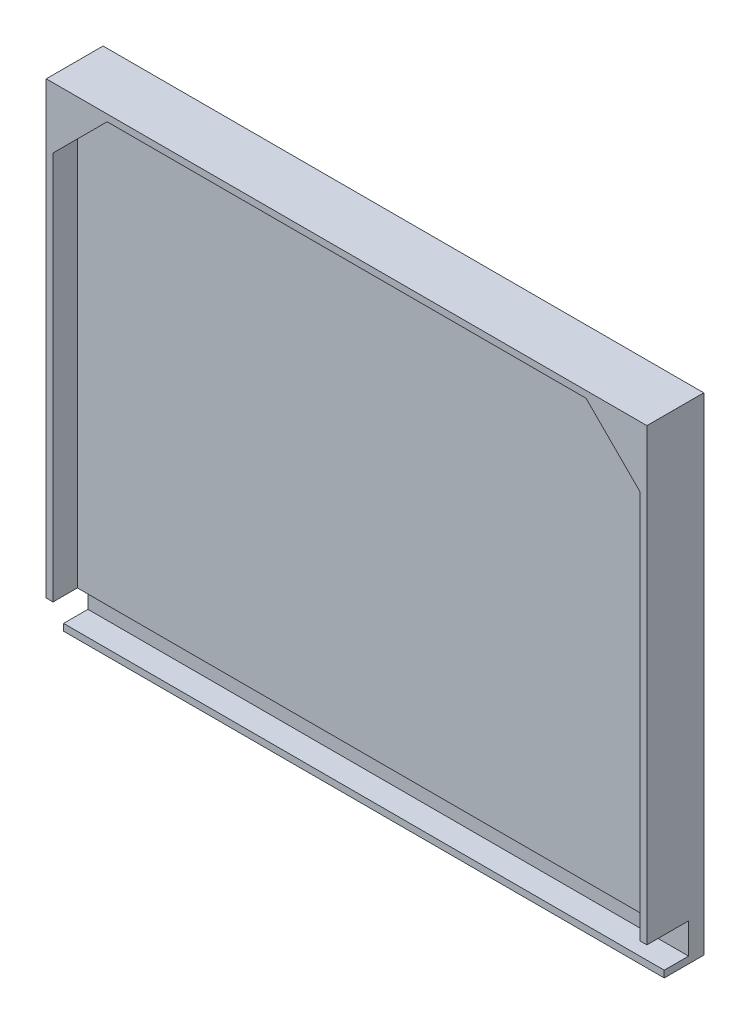
from build123d import *

# Parameters (mm, degrees)
SKETCH1_W            = 281.94
SKETCH1_H            = 228.6
BOSS_EXTRUDE2_DEPTH  = 25.4
SKETCH3_W            = 281.94
SKETCH3_H            = 17.526
CUT_EXTRUDE1_DEPTH   = 8.128
SKETCH4_W            = 11.43
SKETCH4_H            = 211.074
BOSS_EXTRUDE4_DEPTH  = 3.175
SKETCH5_W            = 278.765
SKETCH5_H            = 11.43
BOSS_EXTRUDE9_DEPTH  = 3.175
SKETCH9_W            = 11.43
SKETCH9_H            = 207.899
BOSS_EXTRUDE10_DEPTH = 3.175
SKETCH8_W            = 281.94
SKETCH8_H            = 11.43
BOSS_EXTRUDE11_DEPTH = 3.175
SKETCH10_W           = 281.94
SKETCH10_H           = 14.351
CUT_EXTRUDE2_DEPTH   = 10.16
SKETCH11_W           = 275.59
SKETCH11_H           = 207.899
CUT_EXTRUDE3_DEPTH   = 10.16
CUT_EXTRUDE4_DEPTH   = 10.16
SKETCH13_W           = 281.94
SKETCH13_H           = 3.175
CUT_EXTRUDE5_DEPTH   = 10.16
SHELL4_START         = -65.823170732
SHELL4_DEPTH         = 276.86
BOSS_EXTRUDE12_DEPTH = 3.175


# Read off the part's stored shape, not the designer's step: Shell4
with BuildPart() as part:
    # Sketch1 → Boss-Extrude2 (new body)
    with BuildSketch(Plane.XY):
        with Locations((72.606829268, 16.339634146)):
            Rectangle(SKETCH1_W, SKETCH1_H)
    extrude(amount=BOSS_EXTRUDE2_DEPTH)

    # Sketch3 → Cut-Extrude1 (cut)
    with BuildSketch(Plane.XY.offset(25.4)):
        with Locations((72.606829268, -89.197365854)):
            Rectangle(SKETCH3_W, SKETCH3_H)
    extrude(amount=-CUT_EXTRUDE1_DEPTH, mode=Mode.SUBTRACT)



with BuildPart() as body_2:
    # Sketch4 → Boss-Extrude4 (new body)
    with BuildSketch(Plane.ZY.offset(68.363170732)):
        with Locations((31.115, 25.102634146)):
            Rectangle(SKETCH4_W, SKETCH4_H)
    extrude(amount=-BOSS_EXTRUDE4_DEPTH)


with BuildPart() as part_1:
    add(part.part)

    add(body_2.part)  # Boss-Extrude9 merges body 2
    # Sketch5 → Boss-Extrude9 (add)
    with BuildSketch(Plane(origin=(0, 130.639634146, 0), x_dir=(1, 0, 0), z_dir=(0, 1, 0))):
        with Locations((74.194329268, -31.115)):
            Rectangle(SKETCH5_W, SKETCH5_H)
    extrude(amount=-BOSS_EXTRUDE9_DEPTH)

    # Sketch9 → Boss-Extrude10 (add)
    with BuildSketch(Plane(origin=(213.576829268, 0, 0), x_dir=(0, 0, -1), z_dir=(1, 0, 0))):
        with Locations((-31.115, 23.515134146)):
            Rectangle(SKETCH9_W, SKETCH9_H)
    extrude(amount=-BOSS_EXTRUDE10_DEPTH)


with BuildPart() as body_2_2:
    # Sketch8 → Boss-Extrude11 (new body)
    with BuildSketch(Plane.XZ.offset(97.960365854)):
        with Locations((72.606829268, 22.987)):
            Rectangle(SKETCH8_W, SKETCH8_H)
    extrude(amount=-BOSS_EXTRUDE11_DEPTH)

    # Combine1: union part
    add(part_1.part)

    # Sketch10 → Cut-Extrude2 (cut)
    with BuildSketch(Plane.XY.offset(17.272)):
        with Locations((72.606829268, -87.609865854)):
            Rectangle(SKETCH10_W, SKETCH10_H)
    extrude(amount=-CUT_EXTRUDE2_DEPTH, mode=Mode.SUBTRACT)

    # Sketch11 → Cut-Extrude3 (cut)
    with BuildSketch(Plane.XY.offset(25.4)):
        with Locations((72.606829268, 23.515134146)):
            Rectangle(SKETCH11_W, SKETCH11_H)
    extrude(amount=-CUT_EXTRUDE3_DEPTH, mode=Mode.SUBTRACT)

    # Sketch12 → Cut-Extrude4 (cut)
    with BuildSketch(Plane.XY.offset(36.83)):
        Polygon((-68.363170732, -80.434365854), (-65.188170732, -80.434365854), (-65.188170732, 127.464634146), (210.401829268, 127.464634146), (210.401829268, -80.434365854), (213.576829268, -80.434365854), (213.576829268, 130.639634146), (-68.363170732, 130.639634146), align=None)
    extrude(amount=-CUT_EXTRUDE4_DEPTH, mode=Mode.SUBTRACT)

    # Sketch13 → Cut-Extrude5 (cut)
    with BuildSketch(Plane.XY.offset(28.702)):
        with Locations((72.606829268, -96.372865854)):
            Rectangle(SKETCH13_W, SKETCH13_H)
    extrude(amount=-CUT_EXTRUDE5_DEPTH, mode=Mode.SUBTRACT)

    # Shell4 outline → Shell4 (cut)
    with BuildSketch(Plane.YZ.offset(SHELL4_START)):
        Polygon((-95.420365854, 4.572), (-95.420365854, 2.54), (128.099634146, 2.54), (128.099634146, 12.7), (-77.894365854, 12.7), (-77.894365854, 4.572), align=None)
    extrude(amount=SHELL4_DEPTH, mode=Mode.SUBTRACT)

    # Sketch14 → Boss-Extrude12 (add)
    with BuildSketch(Plane.XY.offset(26.67)):
        Polygon((-65.188170732, 102.064634146), (-39.788170732, 127.464634146), (-65.188170732, 127.464634146), align=None)
        Polygon((185.001829268, 127.464634146), (210.401829268, 102.064634146), (210.401829268, 127.464634146), align=None)
    extrude(amount=-BOSS_EXTRUDE12_DEPTH)


solid = body_2_2.part
